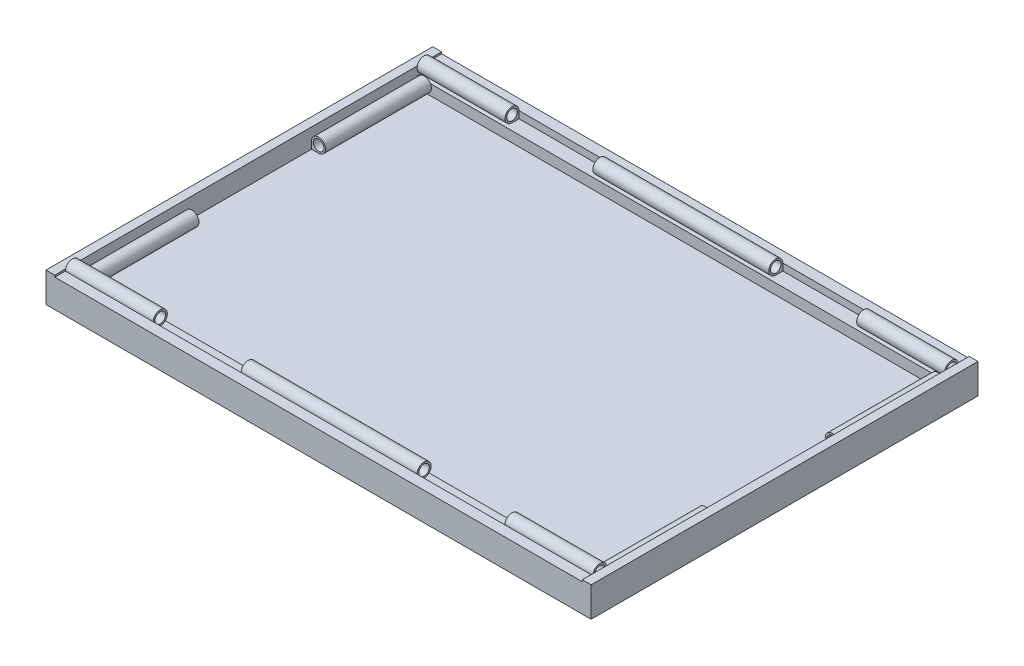
from build123d import *

# Parameters (mm, degrees)
SKETCH_1_W                 = 310
SKETCH_1_H                 = 220
EXTRUDE_1_DEPTH            = 12
SKETCH_8_W                 = 310
SKETCH_8_H                 = 10
EXTRUDE_12_DEPTH           = 4
SKETCH_10_R                = 4
CUT_EXTRUDE_5_DEPTH        = 305
SKETCH_11_W                = 4
SKETCH_11_H                = 4
EXTRUDE_13_DEPTH           = 5
EXTRUDE_START              = 300
SKETCH_12_R                = 4
SKETCH_12_R_2              = 3
EXTRUDE_1_2_DEPTH          = 300
SKETCH_15_W                = 5
SKETCH_15_H                = 220
EXTRUDE_15_DEPTH           = 5
SPLIT_START                = -99.339622642
SPLIT_BODIES_1_OUTLINE_R   = 3
SPLIT_BODIES_1_DEPTH       = 50
SPLIT_START_2              = 50.660377358
SPLIT_BODIES_1_2_OUTLINE_R = 3
SPLIT_BODIES_1_2_DEPTH     = 50
SKETCH_16_W                = 50
SKETCH_16_H                = 8
EXTRUDE_16_DEPTH           = 12
SKETCH_19_W                = 300
SKETCH_19_H                = 192.127016654
CUT_EXTRUDE_6_DEPTH        = 6
SKETCH_22_W                = 4
SKETCH_22_H                = 192.127016654
EXTRUDE_17_DEPTH           = 4
SKETCH_23_R                = 4
CUT_EXTRUDE_8_DEPTH        = 192.127016654
SKETCH_23_3_R              = 4
SKETCH_23_3_R_2            = 3
EXTRUDE_2_DEPTH            = 192.127016654
SPLIT_START_3              = -58.830188679
SPLIT_BODIES_2_OUTLINE_R   = 3
SPLIT_BODIES_2_DEPTH       = 72
SPLIT_START_4              = -58.957205333
SPLIT_BODIES_2_2_OUTLINE_R = 3
SPLIT_BODIES_2_2_DEPTH     = 0.127016654
SKETCH_24_W                = 8
SKETCH_24_H                = 72
SKETCH_24_H_2              = 72.127016654
EXTRUDE_18_DEPTH           = 6


# Read off the part's stored shape, not the designer's step: 分割1, 分割2
with BuildPart() as part:
    # 草图1 → Extrude 1 (new body)
    with BuildSketch(Plane(origin=(0, 0, 0), x_dir=(1, 0, 0), z_dir=(0, 1, 0))):
        with Locations((0.660377358, 22.830188679)):
            Rectangle(SKETCH_1_W, SKETCH_1_H)
    extrude(amount=EXTRUDE_1_DEPTH)

    # 草图8 → 凸台-拉伸12 (add)
    with BuildSketch(Plane(origin=(0, 12, 0), x_dir=(1, 0, 0), z_dir=(0, 1, 0))):
        with Locations((0.660377358, 127.830188679)):
            Rectangle(SKETCH_8_W, SKETCH_8_H)
        with Locations((0.660377358, -82.169811321)):
            Rectangle(SKETCH_8_W, SKETCH_8_H)
    extrude(amount=EXTRUDE_12_DEPTH)

    # 草图10 → 切除-拉伸5 (cut)
    with BuildSketch(Plane(origin=(155.660377358, 0, 0), x_dir=(0, 0, -1), z_dir=(1, 0, 0))):
        with Locations((-77.169811321, 16)):
            Circle(SKETCH_10_R)
        with Locations((122.830188679, 16)):
            Circle(SKETCH_10_R)
    extrude(amount=-CUT_EXTRUDE_5_DEPTH, mode=Mode.SUBTRACT)

    # 草图11 → 凸台-拉伸13 (add)
    with BuildSketch(Plane(origin=(155.660377358, 0, 0), x_dir=(0, 0, -1), z_dir=(1, 0, 0))):
        with Locations((-79.169811321, 14)):
            Rectangle(SKETCH_11_W, SKETCH_11_H)
        with Locations((124.830188679, 14)):
            Rectangle(SKETCH_11_W, SKETCH_11_H)
    extrude(amount=-EXTRUDE_13_DEPTH)

    # 草图12 → Extrude 1 2 (add)
    # profile 1 of 2: a face of its own
    with BuildSketch(Plane(origin=(-149.339622642, 0, 0), x_dir=(0, 0, -1), z_dir=(1, 0, 0)).offset(EXTRUDE_START)):
        with Locations((-77.169811321, 16)):
            Circle(SKETCH_12_R)
        with Locations((-77.169811321, 16)):
            Circle(SKETCH_12_R_2, mode=Mode.SUBTRACT)
    # profile 2 of 2: a face of its own
    with BuildSketch(Plane(origin=(-149.339622642, 0, 0), x_dir=(0, 0, -1), z_dir=(1, 0, 0)).offset(EXTRUDE_START)):
        with Locations((122.830188679, 16)):
            Circle(SKETCH_12_R)
        with Locations((122.830188679, 16)):
            Circle(SKETCH_12_R_2, mode=Mode.SUBTRACT)
    extrude(amount=-EXTRUDE_1_2_DEPTH)

    # 草图15 → 凸台-拉伸15 (add)
    with BuildSketch(Plane(origin=(0, 12, 0), x_dir=(1, 0, 0), z_dir=(0, 1, 0))):
        with Locations((-151.839622642, 22.830188679)):
            Rectangle(SKETCH_15_W, SKETCH_15_H)
        with Locations((153.160377358, 22.830188679)):
            Rectangle(SKETCH_15_W, SKETCH_15_H)
    extrude(amount=EXTRUDE_15_DEPTH)

    # Split Bodies 1 outline → Split Bodies 1 (cut)
    # profile 1 of 2: a face of its own
    with BuildSketch(Plane.YZ.offset(SPLIT_START)):
        with BuildLine():
            ThreePointArc((12, 77.169811321), (18.828427125, 74.341384196), (16, 81.169811321))
            Line((16, 81.169811321), (0, 81.169811321))
            Line((0, 81.169811321), (0, 73.169811321))
            Line((0, 73.169811321), (12, 73.169811321))
            Line((12, 73.169811321), (12, 77.169811321))
        make_face()
        with Locations((16, 77.169811321)):
            Circle(SPLIT_BODIES_1_OUTLINE_R, mode=Mode.SUBTRACT)
    # profile 2 of 2: a face of its own
    with BuildSketch(Plane.YZ.offset(SPLIT_START)):
        with BuildLine():
            Line((12, -118.830188679), (0, -118.830188679))
            Line((0, -118.830188679), (0, -126.830188679))
            Line((0, -126.830188679), (16, -126.830188679))
            ThreePointArc((16, -126.830188679), (18.828427125, -120.001761554), (12, -122.830188679))
            Line((12, -122.830188679), (12, -118.830188679))
        make_face()
        with Locations((16, -122.830188679)):
            Circle(SPLIT_BODIES_1_OUTLINE_R, mode=Mode.SUBTRACT)
    extrude(amount=SPLIT_BODIES_1_DEPTH, mode=Mode.SUBTRACT)

    # Split Bodies 1 2 outline → Split Bodies 1 2 (cut)
    # profile 1 of 2: a face of its own
    with BuildSketch(Plane.YZ.offset(SPLIT_START_2)):
        with BuildLine():
            ThreePointArc((12, 77.169811321), (18.828427125, 74.341384196), (16, 81.169811321))
            Line((16, 81.169811321), (0, 81.169811321))
            Line((0, 81.169811321), (0, 73.169811321))
            Line((0, 73.169811321), (12, 73.169811321))
            Line((12, 73.169811321), (12, 77.169811321))
        make_face()
        with Locations((16, 77.169811321)):
            Circle(SPLIT_BODIES_1_2_OUTLINE_R, mode=Mode.SUBTRACT)
    # profile 2 of 2: a face of its own
    with BuildSketch(Plane.YZ.offset(SPLIT_START_2)):
        with BuildLine():
            Line((12, -118.830188679), (0, -118.830188679))
            Line((0, -118.830188679), (0, -126.830188679))
            Line((0, -126.830188679), (16, -126.830188679))
            ThreePointArc((16, -126.830188679), (18.828427125, -120.001761554), (12, -122.830188679))
            Line((12, -122.830188679), (12, -118.830188679))
        make_face()
        with Locations((16, -122.830188679)):
            Circle(SPLIT_BODIES_1_2_OUTLINE_R, mode=Mode.SUBTRACT)
    extrude(amount=SPLIT_BODIES_1_2_DEPTH, mode=Mode.SUBTRACT)

    # 草图16 → 凸台-拉伸16 (add)
    with BuildSketch(Plane(origin=(0, 12, 0), x_dir=(1, 0, 0), z_dir=(0, 1, 0))):
        with Locations((-74.339622642, 122.830188679)):
            Rectangle(SKETCH_16_W, SKETCH_16_H)
        with Locations((75.660377358, 122.830188679)):
            Rectangle(SKETCH_16_W, SKETCH_16_H)
        with Locations((-74.339622642, -77.169811321)):
            Rectangle(SKETCH_16_W, SKETCH_16_H)
        with Locations((75.660377358, -77.169811321)):
            Rectangle(SKETCH_16_W, SKETCH_16_H)
    extrude(amount=-EXTRUDE_16_DEPTH)

    # 草图19 → 切除-拉伸6 (cut)
    with BuildSketch(Plane(origin=(0, 12, 0), x_dir=(1, 0, 0), z_dir=(0, 1, 0))):
        with Locations((0.660377358, 22.893697006)):
            Rectangle(SKETCH_19_W, SKETCH_19_H)
    extrude(amount=-CUT_EXTRUDE_6_DEPTH, mode=Mode.SUBTRACT)

    # 草图22 → 凸台-拉伸17 (add)
    with BuildSketch(Plane(origin=(0, 6, 0), x_dir=(1, 0, 0), z_dir=(0, 1, 0))):
        with Locations((-147.339622642, 22.893697006)):
            Rectangle(SKETCH_22_W, SKETCH_22_H)
        with Locations((148.660377358, 22.893697006)):
            Rectangle(SKETCH_22_W, SKETCH_22_H)
    extrude(amount=EXTRUDE_17_DEPTH)

    # 草图23 → 切除-拉伸8 (cut)
    with BuildSketch(Plane.XY.offset(-118.957205333)):
        with Locations((-145.339622642, 10)):
            Circle(SKETCH_23_R)
        with Locations((146.660377358, 10)):
            Circle(SKETCH_23_R)
    extrude(amount=CUT_EXTRUDE_8_DEPTH, mode=Mode.SUBTRACT)

    # 草图23<3> → 拉伸-薄壁2 (add)
    # profile 1 of 2: a face of its own
    with BuildSketch(Plane.XY.offset(-118.957205333)):
        with Locations((-145.339622642, 10)):
            Circle(SKETCH_23_3_R)
        with Locations((-145.339622642, 10)):
            Circle(SKETCH_23_3_R_2, mode=Mode.SUBTRACT)
    # profile 2 of 2: a face of its own
    with BuildSketch(Plane.XY.offset(-118.957205333)):
        with Locations((146.660377358, 10)):
            Circle(SKETCH_23_3_R)
        with Locations((146.660377358, 10)):
            Circle(SKETCH_23_3_R_2, mode=Mode.SUBTRACT)
    extrude(amount=EXTRUDE_2_DEPTH)

    # Split Bodies 2 outline → Split Bodies 2 (cut)
    # profile 1 of 2: a face of its own
    with BuildSketch(Plane.XY.offset(SPLIT_START_3)):
        with BuildLine():
            Line((-149.339622642, 0), (-141.339622642, 0))
            Line((-141.339622642, 0), (-141.339622642, 6))
            Line((-141.339622642, 6), (-145.339622642, 6))
            ThreePointArc((-145.339622642, 6), (-142.511195517, 12.828427125), (-149.339622642, 10))
            Line((-149.339622642, 10), (-149.339622642, 0))
        make_face()
        with Locations((-145.339622642, 10)):
            Circle(SPLIT_BODIES_2_OUTLINE_R, mode=Mode.SUBTRACT)
    # profile 2 of 2: a face of its own
    with BuildSketch(Plane.XY.offset(SPLIT_START_3)):
        with BuildLine():
            Line((142.660377358, 6), (142.660377358, 0))
            Line((142.660377358, 0), (150.660377358, 0))
            Line((150.660377358, 0), (150.660377358, 10))
            ThreePointArc((150.660377358, 10), (143.831950234, 12.828427125), (146.660377358, 6))
            Line((146.660377358, 6), (142.660377358, 6))
        make_face()
        with Locations((146.660377358, 10)):
            Circle(SPLIT_BODIES_2_OUTLINE_R, mode=Mode.SUBTRACT)
    extrude(amount=SPLIT_BODIES_2_DEPTH, mode=Mode.SUBTRACT)

    # Split Bodies 2 2 outline → Split Bodies 2 2 (cut)
    with BuildSketch(Plane.XY.offset(SPLIT_START_4)):
        with BuildLine():
            Line((142.660377358, 6), (142.660377358, 0))
            Line((142.660377358, 0), (150.660377358, 0))
            Line((150.660377358, 0), (150.660377358, 10))
            ThreePointArc((150.660377358, 10), (143.831950234, 12.828427125), (146.660377358, 6))
            Line((146.660377358, 6), (142.660377358, 6))
        make_face()
        with Locations((146.660377358, 10)):
            Circle(SPLIT_BODIES_2_2_OUTLINE_R, mode=Mode.SUBTRACT)
    extrude(amount=SPLIT_BODIES_2_2_DEPTH, mode=Mode.SUBTRACT)

    # 草图24 → 凸台-拉伸18 (add)
    with BuildSketch(Plane(origin=(0, 6, 0), x_dir=(1, 0, 0), z_dir=(0, 1, 0))):
        with Locations((-145.339622642, 22.830188679)):
            Rectangle(SKETCH_24_W, SKETCH_24_H)
        with Locations((146.660377358, 22.893697006)):
            Rectangle(SKETCH_24_W, SKETCH_24_H_2)
    extrude(amount=-EXTRUDE_18_DEPTH)


solid = part.part
